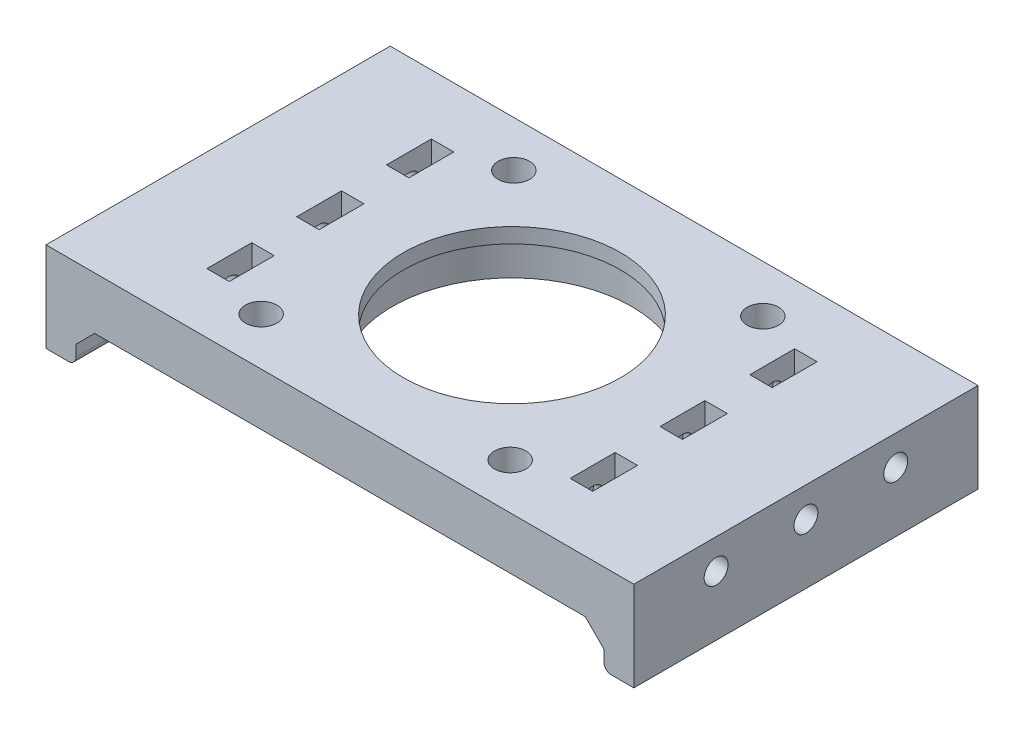
from build123d import *

# Parameters (mm, degrees)
SKETCH1_W                  = 92.56
SKETCH1_H                  = 46
BOSS_EXTRUDE1_DEPTH        = 6
BOSS_EXTRUDE2_DEPTH        = 54
SKETCH3_R                  = 16.000000000000007
CUT_EXTRUDE1_DEPTH         = 120.51298506856901
SKETCH4_R                  = 16.000000000000004
CUT_EXTRUDE2_DEPTH         = 117.61626644683837
F_4_2_4_2_DIAMETER_HOLE1_D = 4.2
F_4_2_4_2_DIAMETER_HOLE2_D = 4.2
CHAMFER1_SIZE              = 3.5
CHAMFER2_SIZE              = 6
BOSS_EXTRUDE3_DEPTH        = 46
FILLET1_R                  = 2.5
CHAMFER3_SIZE              = 2.5
FILLET2_R                  = 2.5
M3_CLEARANCE_HOLE2_D       = 3.2
M3_CLEARANCE_HOLE2_DEPTH   = 30
M3_CLEARANCE_HOLE2_TIP     = 0.9613769904440965
M3_CLEARANCE_HOLE1_D       = 3.2
M3_CLEARANCE_HOLE1_DEPTH   = 30
M3_CLEARANCE_HOLE1_TIP     = 0.9613769904440965
SKETCH18_W                 = 3
SKETCH18_H                 = 6.0000000000000036
CUT_EXTRUDE4_DEPTH         = 121.62318848380691
SKETCH19_R                 = 16.000000000000004
SKETCH19_R_2               = 14.499999999999998
BOSS_EXTRUDE10_DEPTH       = 1
SKETCH21_R                 = 16.000000000000004
SKETCH21_R_2               = 2.09999999999999
SKETCH21_R_3               = 2.0999999999999934
BOSS_EXTRUDE12_DEPTH       = 3
FILLET3_R                  = 10
SKETCH22_W                 = 3.9999999999999716
SKETCH22_H                 = 2.4999999999999836
SKETCH22_W_2               = 4.000000000000001
SKETCH22_H_2               = 2.5
CUT_EXTRUDE5_DEPTH         = 98.88009812622792
SKETCH23_W                 = 4.000000000000001
SKETCH23_H                 = 46
BOSS_EXTRUDE13_DEPTH       = 2.5
FILLET4_R                  = 1
CUT_EXTRUDE6_START         = -3
CUT_EXTRUDE6_DEPTH         = 3
BOSS_EXTRUDE14_START       = 1
SKETCH25_R                 = 2.09999999999999
SKETCH25_R_2               = 2.0999999999999934
SKETCH25_R_3               = 14.499999999999998
BOSS_EXTRUDE14_DEPTH       = 1


with BuildPart() as part:
    # Sketch1 → Boss-Extrude1 (new body)
    with BuildSketch(Plane(origin=(0, 0, 0), x_dir=(1, 0, 0), z_dir=(0, 1, 0))):
        with Locations((46.28, 23)):
            Rectangle(SKETCH1_W, SKETCH1_H)
    extrude(amount=BOSS_EXTRUDE1_DEPTH)

    # Sketch2 → Boss-Extrude2 (add)
    with BuildSketch(Plane(origin=(0, 6, 0), x_dir=(1, 0, 0), z_dir=(0, 1, 0))):
        Polygon((92.56, 46), (85.56000000000003, 46), (85.56000000000002, 0), (92.56, 0), align=None)
        Polygon((0, 46), (6.999999999999999, 45.999999999999986), (6.999999999999999, 0), (0, 0), align=None)
    extrude(amount=BOSS_EXTRUDE2_DEPTH)

    # Sketch3 → Cut-Extrude1 (cut, through all)
    with BuildSketch(Plane(origin=(92.56, 0, 0), x_dir=(0, 0, -1), z_dir=(1, 0, 0))):
        with Locations((22.999999999999996, 37)):
            Circle(SKETCH3_R)
    extrude(amount=-CUT_EXTRUDE1_DEPTH, mode=Mode.SUBTRACT)

    # Sketch4 → Cut-Extrude2 (cut, through all)
    with BuildSketch(Plane(origin=(0, 6, 0), x_dir=(1, 0, 0), z_dir=(0, 1, 0))):
        with Locations(Location((46.28, 23, 0), (0, 0, 270))):
            Circle(SKETCH4_R)
    extrude(amount=-CUT_EXTRUDE2_DEPTH, mode=Mode.SUBTRACT)

    # Ø4.2 (4.2) Diameter Hole1 (through all)
    with Locations(Plane(origin=(0, 0, 0), x_dir=(-1, 0, 0), z_dir=(0, -1, 0))):
        with Locations((-63.165621688, 39.642079068), (-29.637920932, 39.885621688), (-29.394378312, 6.357920932), (-62.922079068, 6.114378312)):
            Hole(F_4_2_4_2_DIAMETER_HOLE1_D / 2)

    # Ø4.2 (4.2) Diameter Hole2 (through all)
    with Locations(Plane.ZY):
        with Locations((-39.885621688, 53.642079068), (-6.357920932, 53.885621688), (-6.114378312, 20.357920932), (-39.642079068, 20.114378312)):
            Hole(F_4_2_4_2_DIAMETER_HOLE2_D / 2)

    # Chamfer1
    chamfer1_edges = [part.edges().sort_by_distance(p)[0] for p in [
        (89.06000000000002, 60, -46),
        (89.06, 60, 0),
        (3.4999999999999996, 60, 0),
        (3.4999999999999996, 60, -45.99999999999999),
    ]]
    chamfer(chamfer1_edges, length=CHAMFER1_SIZE)

    # Chamfer2
    chamfer2_edges = [part.edges().sort_by_distance(p)[0] for p in [
        (85.56000000000003, 6, -23),
        (6.999999999999999, 6, -22.999999999999993),
    ]]
    chamfer(chamfer2_edges, length=CHAMFER2_SIZE)

    # Sketch10 → Boss-Extrude3 (add)
    with BuildSketch(Plane(origin=(0, 0, -46), x_dir=(-1, 0, 0), z_dir=(0, 0, -1))):
        Polygon((7.5e-16, 11.000000000000002), (5.000000000000001, 11), (4.9999999999999885, -4.999999999999999), (-11.000000000000004, -4.999999999999989), (-10.999999999999996, 0), (0, 0), align=None)
        Polygon((-81.56000000000003, 0), (-92.56000000000003, 0), (-92.56000000000003, 11.000000000000002), (-97.56000000000003, 11), (-97.56000000000002, -4.999999999999999), (-81.56000000000002, -4.999999999999989), align=None)
    extrude(amount=-BOSS_EXTRUDE3_DEPTH)

    # Fillet1
    fillet1_edges = [part.edges().sort_by_distance(p)[0] for p in [
        (-5.000000000000001, 11, -23),
        (11.000000000000004, -4.999999999999989, -23),
        (81.56000000000002, -4.999999999999989, -23),
        (97.56000000000003, 11, -23),
    ]]
    fillet(fillet1_edges, radius=FILLET1_R)

    # Chamfer3
    chamfer3_edges = [part.edges().sort_by_distance(p)[0] for p in [
        (92.56000000000003, 11.000000000000002, -23),
        (81.56000000000003, 0, -23),
        (10.999999999999996, 0, -23),
        (-7.5e-16, 11.000000000000002, -23),
    ]]
    chamfer(chamfer3_edges, length=CHAMFER3_SIZE - 0.0001)  # a hair under: the kernel refuses the full size

    # Fillet2
    fillet2_edges = [part.edges().sort_by_distance(p)[0] for p in [
        (-4.9999999999999885, -4.999999999999999, -23),
        (97.56000000000002, -4.999999999999999, -23),
    ]]
    fillet(fillet2_edges, radius=FILLET2_R)

    # M3 Clearance Hole2
    with Locations(Plane.ZY.offset(4.999999999999992)):
        with Locations((-11, 3), (-23, 3), (-35, 3)):
            Hole(M3_CLEARANCE_HOLE2_D / 2, depth=M3_CLEARANCE_HOLE2_DEPTH)
            with Locations((0, 0, -(M3_CLEARANCE_HOLE2_DEPTH + M3_CLEARANCE_HOLE2_TIP / 2))):  # 118° drill point
                Cone(0, M3_CLEARANCE_HOLE2_D / 2, M3_CLEARANCE_HOLE2_TIP, mode=Mode.SUBTRACT)

    # M3 Clearance Hole1
    with Locations(Plane(origin=(97.56000000000002, -8.462e-14, 0), x_dir=(0, 0, -1), z_dir=(1, -8.7e-16, 0))):
        with Locations((11, 3), (23, 3), (35, 3)):
            Hole(M3_CLEARANCE_HOLE1_D / 2, depth=M3_CLEARANCE_HOLE1_DEPTH)
            with Locations((0, 0, -(M3_CLEARANCE_HOLE1_DEPTH + M3_CLEARANCE_HOLE1_TIP / 2))):  # 118° drill point
                Cone(0, M3_CLEARANCE_HOLE1_D / 2, M3_CLEARANCE_HOLE1_TIP, mode=Mode.SUBTRACT)

    # Sketch18 → Cut-Extrude4 (cut, through all)
    with BuildSketch(Plane(origin=(0, 6, 0), x_dir=(1, 0, 0), z_dir=(0, 1, 0))):
        with Locations((21.999999999999996, 23)):
            Rectangle(SKETCH18_W, SKETCH18_H)
        Polygon((20.499999999999957, 38), (20.499999999999957, 32), (23.499999999999954, 32), (23.499999999999954, 38.00000000000001), align=None)
        Polygon((20.50000000000012, 13.999999999999998), (20.50000000000012, 8), (23.50000000000012, 8), (23.50000000000012, 14.000000000000002), align=None)
    cut_extrude4 = extrude(amount=-CUT_EXTRUDE4_DEPTH, mode=Mode.SUBTRACT)

    # Mirror1: Cut-Extrude4 across plane
    add(cut_extrude4.mirror(Plane.ZY.offset(-46.280000000000015)), mode=Mode.SUBTRACT)

    # SurfaceCut1
    split(bisect_by=Plane(origin=(6.999999999999999, 0, 0), x_dir=(0, 0, -1), z_dir=(1, 0, 0)), keep=Keep.TOP)

    # SurfaceCut2
    split(bisect_by=Plane.ZY.offset(-85.56000000000002), keep=Keep.TOP)

    # Sketch19 → Boss-Extrude10 (add)
    with BuildSketch(Plane(origin=(0, 6, 0), x_dir=(1, 0, 0), z_dir=(0, 1, 0))):
        with Locations(Location((46.28, 23, 0), (0, 0, 270))):
            Circle(SKETCH19_R)
        with Locations(Location((46.28, 23, 0), (0, 0, 270))):
            Circle(SKETCH19_R_2, mode=Mode.SUBTRACT)
    extrude(amount=-BOSS_EXTRUDE10_DEPTH)

    # Sketch21 → Boss-Extrude12 (add)
    with BuildSketch(Plane.XZ):
        with BuildLine():
            ThreePointArc((31.733605244214736, -10.77697256777753), (27.280501243582478, -23.138010886850143), (31.912705111035624, -35.43305423351552))
            ThreePointArc((31.912705111035624, -35.43305423351552), (26.128161464854706, -43.446743489319495), (34.056972567779034, -37.54639475578653))
            ThreePointArc((34.056972567779034, -37.54639475578653), (46.418010886852265, -41.99949875641751), (58.71305423351724, -37.36729488896288))
            ThreePointArc((58.71305423351724, -37.36729488896288), (66.72674348932048, -43.15183853514533), (60.82639475578562, -35.22302743222205))
            ThreePointArc((60.82639475578562, -35.22302743222205), (65.27949875641751, -22.861989113148052), (60.64729488896237, -10.566945766482164))
            ThreePointArc((60.64729488896237, -10.566945766482164), (66.43183853514634, -2.553256510679747), (58.50302743222354, -8.453605244215632))
            ThreePointArc((58.50302743222354, -8.453605244215632), (46.14198911315015, -4.000501243582477), (33.84694576648387, -8.63270511103615))
            ThreePointArc((33.84694576648387, -8.63270511103615), (25.833256510680727, -2.848161464853713), (31.733605244214736, -10.77697256777753))
        make_face()
        with Locations(Location((46.28, -23, 0), (0, 0, 90))):
            Circle(SKETCH21_R, mode=Mode.SUBTRACT)
        with Locations(Location((63.16562168832614, -39.642079067819566, 0), (0, 0, 270))):
            Circle(SKETCH21_R_2, mode=Mode.SUBTRACT)
        with Locations(Location((62.92207906782046, -6.114378311673986, 0), (0, 0, 270))):
            Circle(SKETCH21_R_2, mode=Mode.SUBTRACT)
        with Locations(Location((29.39437831167488, -6.357920932179663, 0), (0, 0, 270))):
            Circle(SKETCH21_R_3, mode=Mode.SUBTRACT)
        with Locations(Location((29.637920932180556, -39.88562168832524, 0), (0, 0, 270))):
            Circle(SKETCH21_R_3, mode=Mode.SUBTRACT)
    extrude(amount=BOSS_EXTRUDE12_DEPTH)

    # Fillet3
    fillet3_edges = [part.edges().sort_by_distance(p)[0] for p in [
        (34.05697256777903, -1.5, -37.54639475578654),
        (58.71305423351724, -1.5, -37.367294888962874),
        (60.82639475578563, -1.5, -35.223027432222054),
        (60.64729488896237, -1.5, -10.566945766482165),
        (58.50302743222355, -1.5, -8.45360524421563),
        (33.84694576648387, -1.5, -8.632705111036152),
        (31.733605244214736, -1.5, -10.77697256777753),
        (31.912705111035624, -1.5, -35.43305423351552),
    ]]
    fillet(fillet3_edges, radius=FILLET3_R)

    # Sketch22 → Cut-Extrude5 (cut, through all)
    with BuildSketch(Plane.XY):
        Polygon((6.999999999999999, 6), (85.56000000000003, 6), (85.56000000000002, 12.000000000000032), (6.999999999999999, 12.000000000000032), align=None)
        with Locations((83.56000000000002, -3.75)):
            Rectangle(SKETCH22_W, SKETCH22_H)
        with Locations((9, -3.749999999999991)):
            Rectangle(SKETCH22_W_2, SKETCH22_H_2)
    extrude(amount=-CUT_EXTRUDE5_DEPTH, mode=Mode.SUBTRACT)

    # Sketch23 → Boss-Extrude13 (add)
    with BuildSketch(Plane.XZ.offset(2.499999999999991)):
        Polygon((85.56, 0), (81.56000000000003, 0), (81.56000000000003, -46), (85.56000000000003, -46), align=None)
        with Locations((9, -23)):
            Rectangle(SKETCH23_W, SKETCH23_H)
    extrude(amount=BOSS_EXTRUDE13_DEPTH)

    # Fillet4
    fillet4_edges = [part.edges().sort_by_distance(p)[0] for p in [
        (81.56000000000003, -4.999999999999991, -23),
        (11, -4.999999999999991, -23),
    ]]
    fillet(fillet4_edges, radius=FILLET4_R)

    # Sketch24 → Cut-Extrude6 (cut)
    with BuildSketch(Plane.XZ.offset(3).offset(CUT_EXTRUDE6_START)):
        with BuildLine():
            ThreePointArc((25.820984830449497, -36.655916005867134), (26.128161464854706, -43.4467434893195), (32.92273473501672, -43.655236825271864))
            ThreePointArc((32.92273473501672, -43.655236825271864), (37.11273732148315, -41.481723677867), (41.83292705079626, -41.47223706497024))
            ThreePointArc((41.83292705079626, -41.47223706497024), (46.41801088685131, -41.99949875641751), (50.99495131648547, -41.40568483059437))
            ThreePointArc((50.99495131648547, -41.40568483059437), (55.714780767284765, -41.34659987559651), (59.93591600586793, -43.45901516955053))
            ThreePointArc((59.93591600586793, -43.45901516955053), (66.72674348932048, -43.15183853514533), (66.93523682527251, -36.357265264983134))
            ThreePointArc((66.93523682527251, -36.357265264983134), (64.76172367786731, -32.16726267851662), (64.75223706497036, -27.447072949203285))
            ThreePointArc((64.75223706497036, -27.447072949203285), (65.27949875641752, -22.861989113148752), (64.68568483059452, -18.285048683515118))
            ThreePointArc((64.68568483059452, -18.285048683515118), (64.62659987559687, -13.565219232715643), (66.73901516955122, -9.344083994132449))
            ThreePointArc((66.73901516955122, -9.344083994132449), (66.43183853514634, -2.55325651067974), (59.637265264984, -2.3447631747276247))
            ThreePointArc((59.637265264984, -2.3447631747276247), (55.44726267851733, -4.518276322132929), (50.72707294920381, -4.527762935029777))
            ThreePointArc((50.72707294920381, -4.527762935029777), (46.141989113149215, -4.000501243582487), (41.565048683515485, -4.594315169405377))
            ThreePointArc((41.565048683515485, -4.594315169405377), (36.845219232716246, -4.6534001244030065), (32.62408399413323, -2.5409848304488194))
            ThreePointArc((32.62408399413323, -2.5409848304488194), (25.833256510680723, -2.8481614648537166), (25.624763174728287, -9.642734735015843))
            ThreePointArc((25.624763174728287, -9.642734735015843), (27.798276322133216, -13.832737321482442), (27.807762935029885, -18.552927050795727))
            ThreePointArc((27.807762935029885, -18.552927050795727), (27.280501243582485, -23.138010886850843), (27.874315169405524, -27.71495131648509))
            ThreePointArc((27.874315169405524, -27.71495131648509), (27.93340012440335, -32.434780767284145), (25.820984830449497, -36.655916005867134))
        make_face()
    extrude(amount=CUT_EXTRUDE6_DEPTH, mode=Mode.SUBTRACT)

    # Sketch25 → Boss-Extrude14 (add)
    with BuildSketch(Plane(origin=(0, 6, 0), x_dir=(1, 0, 0), z_dir=(0, 1, 0)).offset(BOSS_EXTRUDE14_START)):
        Polygon((85.56000000000003, 46), (6.999999999999999, 46), (6.999999999999999, 0), (85.56000000000002, 0), align=None)
        with Locations(Location((62.92207906782046, 6.114378311673986, 0), (0, 0, 90))):
            Circle(SKETCH25_R, mode=Mode.SUBTRACT)
        with Locations(Location((29.39437831167488, 6.357920932179663, 0), (0, 0, 90))):
            Circle(SKETCH25_R_2, mode=Mode.SUBTRACT)
        with Locations(Location((29.637920932180556, 39.88562168832524, 0), (0, 0, 90))):
            Circle(SKETCH25_R_2, mode=Mode.SUBTRACT)
        with Locations(Location((63.16562168832614, 39.642079067819566, 0), (0, 0, 90))):
            Circle(SKETCH25_R, mode=Mode.SUBTRACT)
        with Locations(Location((46.28, 23, 0), (0, 0, 270))):
            Circle(SKETCH25_R_3, mode=Mode.SUBTRACT)
        Polygon((72.06000000000007, 32), (69.06000000000007, 32), (69.06000000000007, 38.00000000000001), (72.06000000000007, 38), align=None, mode=Mode.SUBTRACT)
        Polygon((23.50000000000007, 31.99999999999966), (20.50000000000008, 31.99999999999966), (20.50000000000008, 37.999999999999666), (23.50000000000007, 37.99999999999966), align=None, mode=Mode.SUBTRACT)
        Polygon((23.500000000000195, 19.999999999999662), (20.500000000000206, 19.999999999999662), (20.500000000000206, 25.99999999999967), (23.500000000000195, 25.999999999999662), align=None, mode=Mode.SUBTRACT)
        Polygon((23.50000000000032, 7.999999999999667), (20.50000000000033, 7.999999999999667), (20.50000000000033, 13.999999999999673), (23.50000000000032, 13.999999999999666), align=None, mode=Mode.SUBTRACT)
        Polygon((72.06000000000019, 20.000000000000004), (69.0600000000002, 20.000000000000004), (69.0600000000002, 26.00000000000001), (72.06000000000019, 26.000000000000004), align=None, mode=Mode.SUBTRACT)
        Polygon((72.06000000000031, 8.000000000000007), (69.06000000000033, 8.000000000000007), (69.06000000000033, 14.000000000000012), (72.06000000000031, 14.000000000000005), align=None, mode=Mode.SUBTRACT)
    extrude(amount=-BOSS_EXTRUDE14_DEPTH)


solid = part.part
